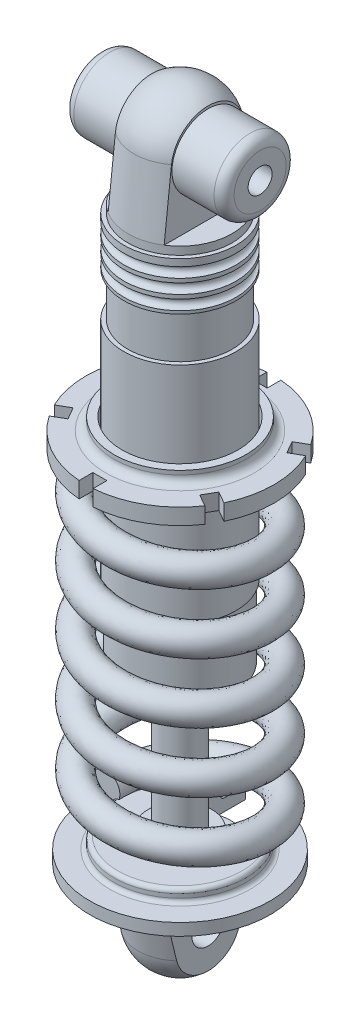
from build123d import *

# Parameters (mm, degrees)
SKETCH1_R           = 14
EXTRUDE1_DEPTH      = 99
SKETCH2_R           = 1.25
SKETCH2_W           = 0.5
SKETCH2_H           = 18
SKETCH2_W_2         = 1
SKETCH2_H_2         = 11
SKETCH2_H_3         = 2
EXTRUDE2_DEPTH      = 128.546070108
EXTRUDE2_DEPTH_BACK = 128.546070108
SKETCH4_W           = 6
SKETCH4_H           = 28
SKETCH6_R           = 9
EXTRUDE3_DEPTH      = 20
EXTRUDE4_DEPTH      = 129.343289657
EXTRUDE4_DEPTH_BACK = 129.343289657
SKETCH7_R           = 3
FILLET1_R           = 2
SKETCH9_W           = 3.5
SKETCH9_H           = 5
EXTRUDE5_DEPTH      = 10
CIRPATTERN1_COUNT   = 6
SKETCH10_R          = 5
EXTRUDE6_DEPTH      = 36
SKETCH11_R          = 8
EXTRUDE7_DEPTH      = 5
EXTRUDE8_START      = 3
SKETCH12_R          = 13
EXTRUDE8_DEPTH      = 3
EXTRUDE9_DEPTH      = 131.297496139
EXTRUDE9_DEPTH_BACK = 131.297496139
SKETCH14_W          = 6
SKETCH14_H          = 22
SKETCH18_W          = 11
SKETCH18_H          = 22
EXTRUDE12_DEPTH     = 28
SWEEP2_PITCH        = 15
SWEEP2_HEIGHT       = 78.75
SWEEP2_RADIUS       = 22
SKETCH20_R          = 3.5
FILLET2_R           = 2.5
SKETCH22_R          = 4
CUT_EXTRUDE3_DEPTH  = 132.740037574


with BuildPart() as part:
    # Sketch1 → Extrude1 (new body)
    with BuildSketch(Plane(origin=(0, 0, 0), x_dir=(1, 0, 0), z_dir=(0, 1, 0))):
        with Locations(Location((0, 0, 0), (0, 0, 270))):
            Circle(SKETCH1_R)
    extrude(amount=EXTRUDE1_DEPTH)

    # Sketch2 → Cut-Revolve1 (revolve, cut)
    with BuildSketch(Plane(origin=(0, 0, 0), x_dir=(0, 0, -1), z_dir=(1, 0, 0))):
        with Locations((14, 87)):
            Circle(SKETCH2_R)
        with Locations((14, 90.5)):
            Circle(SKETCH2_R)
        with Locations((14, 94)):
            Circle(SKETCH2_R)
        with Locations((13.75, 9)):
            Rectangle(SKETCH2_W, SKETCH2_H)
        with Locations((13.5, 79.5)):
            Rectangle(SKETCH2_W_2, SKETCH2_H_2)
        with Locations((13.5, 98)):
            Rectangle(SKETCH2_W_2, SKETCH2_H_3)
    revolve(axis=Axis((0, 0, 0), (0, 1, 0)), mode=Mode.SUBTRACT)

    # Sketch3 → Revolve1 (revolve)
    with BuildSketch(Plane(origin=(0, 0, 0), x_dir=(0, 0, -1), z_dir=(1, 0, 0))):
        with BuildLine():
            Line((11.5, 115.498138919), (13, 99))
            Line((13, 99), (0, 99))
            Line((0, 99), (0, 126))
            ThreePointArc((0, 126), (7.786833216, 122.979491459), (11.5, 115.498138919))
        make_face()
    revolve(axis=Axis((0, 99, 0), (0, 1, 0)))

    # Sketch4 → Extrude2 (cut, two sides: drawn at the far end of the back side and taken through both)
    with BuildSketch(Plane.XY.offset(-EXTRUDE2_DEPTH_BACK)):
        with Locations((-10, 113)):
            Rectangle(SKETCH4_W, SKETCH4_H)
        with Locations((10, 113)):
            Rectangle(SKETCH4_W, SKETCH4_H)
    extrude(amount=EXTRUDE2_DEPTH + EXTRUDE2_DEPTH_BACK, mode=Mode.SUBTRACT)

    # Sketch6 → Extrude3 (add, symmetric)
    with BuildSketch(Plane(origin=(0, 0, 0), x_dir=(0, 0, -1), z_dir=(1, 0, 0))):
        with Locations((0, 114)):
            Circle(SKETCH6_R)
    extrude(amount=EXTRUDE3_DEPTH, both=True)

    # Sketch7 → Extrude4 (cut, two sides: drawn at the far end of the back side and taken through both)
    with BuildSketch(Plane(origin=(0, 0, 0), x_dir=(0, 0, -1), z_dir=(1, 0, 0)).offset(-EXTRUDE4_DEPTH_BACK)):
        with Locations((0, 114)):
            Circle(SKETCH7_R)
    extrude(amount=EXTRUDE4_DEPTH + EXTRUDE4_DEPTH_BACK, mode=Mode.SUBTRACT)

    # Sketch10 → Extrude6 (add)
    with BuildSketch(Plane.XZ):
        with Locations(Location((0, 0, 0), (0, 0, 90))):
            Circle(SKETCH10_R)
    extrude(amount=EXTRUDE6_DEPTH)

    # Sketch11 → Extrude7 (add)
    with BuildSketch(Plane.XZ.offset(36)):
        with Locations(Location((0, 0, 0), (0, 0, 270))):
            Circle(SKETCH11_R)
    extrude(amount=EXTRUDE7_DEPTH)

    # Sketch12 → Extrude8 (add)
    with BuildSketch(Plane.XZ.offset(41).offset(EXTRUDE8_START)):
        with Locations(Location((0, 0, 0), (0, 0, 270))):
            Circle(SKETCH12_R)
    extrude(amount=-EXTRUDE8_DEPTH)

    # Sketch13 → Revolve3 (revolve)
    with BuildSketch(Plane(origin=(0, 0, 0), x_dir=(0, 0, -1), z_dir=(1, 0, 0)), mode=Mode.PRIVATE) as revolve3_sk:
        with BuildLine():
            Line((0, -44), (-13, -44))
            Line((-13, -44), (-10.5, -57.290899459))
            ThreePointArc((-10.5, -57.290899459), (-6.82089496, -63.539376319), (0, -66))
            Line((0, -66), (0, -44))
        make_face()
    revolve(revolve3_sk.sketch.rotate(Axis((0, -44, 0), (0, 1, 0)), 180), axis=Axis((0, -44, 0), (0, 1, 0)))

    # Sketch14 → Extrude9 (cut, two sides: drawn at the far end of the back side and taken through both)
    with BuildSketch(Plane.XY.offset(-EXTRUDE9_DEPTH_BACK)):
        with Locations((-10, -55)):
            Rectangle(SKETCH14_W, SKETCH14_H)
        with Locations((10, -55)):
            Rectangle(SKETCH14_W, SKETCH14_H)
    extrude(amount=EXTRUDE9_DEPTH + EXTRUDE9_DEPTH_BACK, mode=Mode.SUBTRACT)

    # Fillet2
    fillet2_edges = [part.edges().sort_by_distance(p)[0] for p in [
        (-20, 114, 9),
        (20, 114, 9),
    ]]
    fillet(fillet2_edges, radius=FILLET2_R)

    # Sketch22 → Cut-Extrude3 (cut, through all)
    with BuildSketch(Plane(origin=(7, 0, 0), x_dir=(0, 0, -1), z_dir=(1, 0, 0))):
        with Locations(Location((0, -54, 0), (0, 0, 90))):
            Circle(SKETCH22_R)
    extrude(amount=-CUT_EXTRUDE3_DEPTH, mode=Mode.SUBTRACT)


with BuildPart() as body_2:
    # Sketch8 → Revolve2 (revolve)
    with BuildSketch(Plane(origin=(0, 0, 0), x_dir=(0, 0, -1), z_dir=(1, 0, 0))):
        Polygon((14.5, 53), (14.5, 43), (15.5, 43), (15.5, 46), (23.5, 46), (23.5, 50), (16.5, 50), (16.5, 53), align=None)
    revolve(axis=Axis((0, 74, 0), (0, -1, 0)))

    # Fillet1
    fillet1_edges = [body_2.edges().sort_by_distance(p)[0] for p in [
        (0, 50, 16.5),
    ]]
    fillet(fillet1_edges, radius=FILLET1_R)

    # Sketch9 → Extrude5 (cut)
    with BuildSketch(Plane(origin=(0, 50, 0), x_dir=(1, 0, 0), z_dir=(0, 1, 0))):
        with Locations((0, 22.5)):
            Rectangle(SKETCH9_W, SKETCH9_H)
    extrude5 = extrude(amount=-EXTRUDE5_DEPTH, mode=Mode.SUBTRACT)

    # CirPattern1: Extrude5 ×6 about axis
    cirpattern1_axis = Axis((0, 0, 0), (0, 1, 0))
    for i in range(1, CIRPATTERN1_COUNT):
        add(extrude5.rotate(cirpattern1_axis, i * 360 / CIRPATTERN1_COUNT), mode=Mode.SUBTRACT)


with BuildPart() as body_3:
    # Sketch17 → Revolve4 (revolve)
    with BuildSketch(Plane(origin=(0, 0, 0), x_dir=(0, 0, -1), z_dir=(1, 0, 0)), mode=Mode.PRIVATE) as revolve4_sk:
        with BuildLine():
            Line((0, -37.5), (0, -40.5))
            Line((0, -40.5), (13.5, -40.5))
            Line((13.5, -40.5), (13.5, -42.5))
            ThreePointArc((13.5, -42.5), (13.792893219, -43.207106781), (14.5, -43.5))
            Line((14.5, -43.5), (22.5, -43.5))
            Line((22.5, -43.5), (22.5, -40.5))
            Line((22.5, -40.5), (17.5, -40.5))
            ThreePointArc((17.5, -40.5), (16.792893219, -40.207106781), (16.5, -39.5))
            Line((16.5, -39.5), (16.5, -38.5))
            ThreePointArc((16.5, -38.5), (16.207106781, -37.792893219), (15.5, -37.5))
            Line((15.5, -37.5), (0, -37.5))
        make_face()
    revolve(revolve4_sk.sketch.rotate(Axis((0, -37.5, 0), (0, -1, 0)), 180), axis=Axis((0, -37.5, 0), (0, -1, 0)))

    # Sketch18 → Extrude12 (cut)
    with BuildSketch(Plane(origin=(0, -37.5, 0), x_dir=(1, 0, 0), z_dir=(0, 1, 0))):
        with Locations((0, 15)):
            Rectangle(SKETCH18_W, SKETCH18_H)
    extrude(amount=-EXTRUDE12_DEPTH, mode=Mode.SUBTRACT)


with BuildPart() as body_4:
    # Sweep2: sweep along a helix
    with BuildLine() as sweep2_path:
        Helix(SWEEP2_PITCH, SWEEP2_HEIGHT, SWEEP2_RADIUS, center=(0, 46, 0), direction=(0, -1, 0), lefthand=True)
    # Sketch20 → Sweep2 (sweep)
    with BuildSketch(Plane(origin=(0, 0, 0), x_dir=(0, 0, -1), z_dir=(1, 0, 0))):
        with Locations((18.5, 42.5)):
            Circle(SKETCH20_R)
    sweep(path=sweep2_path.line, is_frenet=True)


solid = Compound([part.part, body_2.part, body_3.part, body_4.part])
